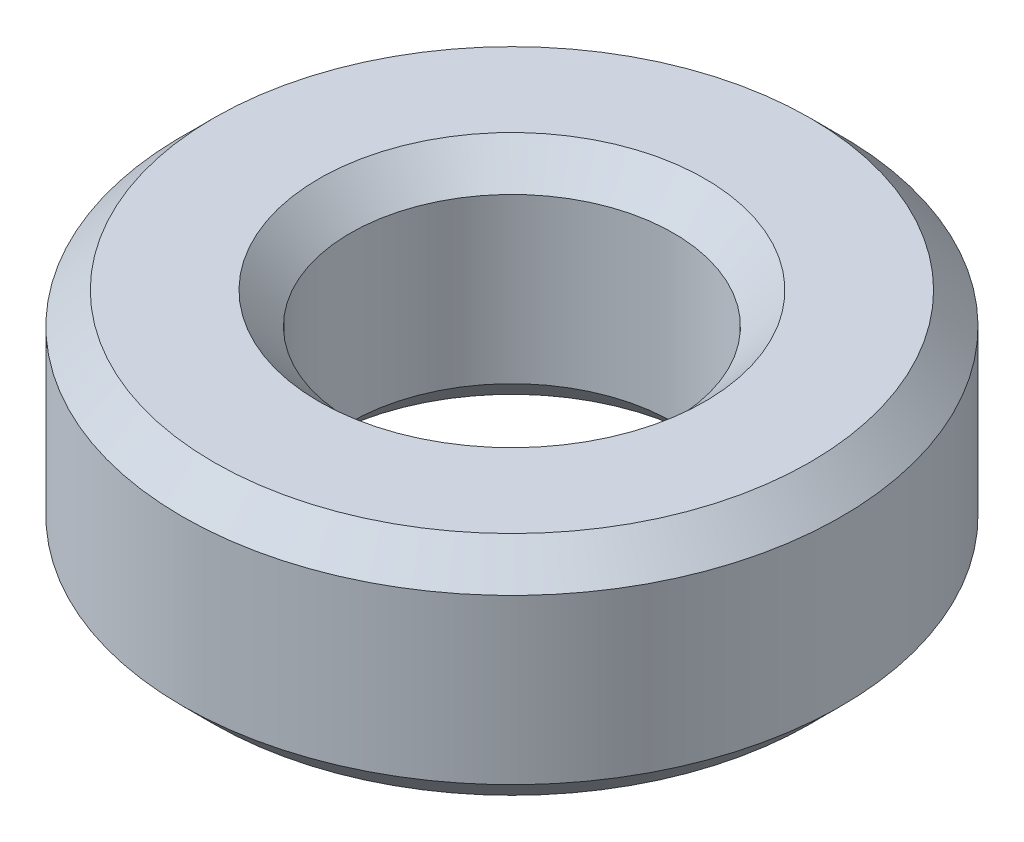
from build123d import *

# Parameters (mm, degrees)
SKETCH1_R           = 30
BOSS_EXTRUDE1_DEPTH = 20.637949487
SKETCH2_R           = 14.710867861
CUT_EXTRUDE1_DEPTH  = 48.179709187
CHAMFER1_SIZE       = 2.859252345


with BuildPart() as part:
    # Sketch1 → Boss-Extrude1 (new body)
    with BuildSketch(Plane(origin=(0, 0, 0), x_dir=(1, 0, 0), z_dir=(0, 1, 0))):
        Circle(SKETCH1_R)
    extrude(amount=BOSS_EXTRUDE1_DEPTH)

    # Sketch2 → Cut-Extrude1 (cut, through all)
    with BuildSketch(Plane(origin=(0, 0, 0), x_dir=(1, 0, 0), z_dir=(0, 1, 0))):
        Circle(SKETCH2_R)
    extrude(amount=CUT_EXTRUDE1_DEPTH, mode=Mode.SUBTRACT)

    # Chamfer1
    chamfer1_edges = [part.edges().sort_by_distance(p)[0] for p in [
        (-14.710867861, 20.637949487, 0),
        (-14.710867861, 0, 0),
        (-30, 0, 0),
        (-30, 20.637949487, 0),
    ]]
    chamfer(chamfer1_edges, length=CHAMFER1_SIZE)


solid = part.part
